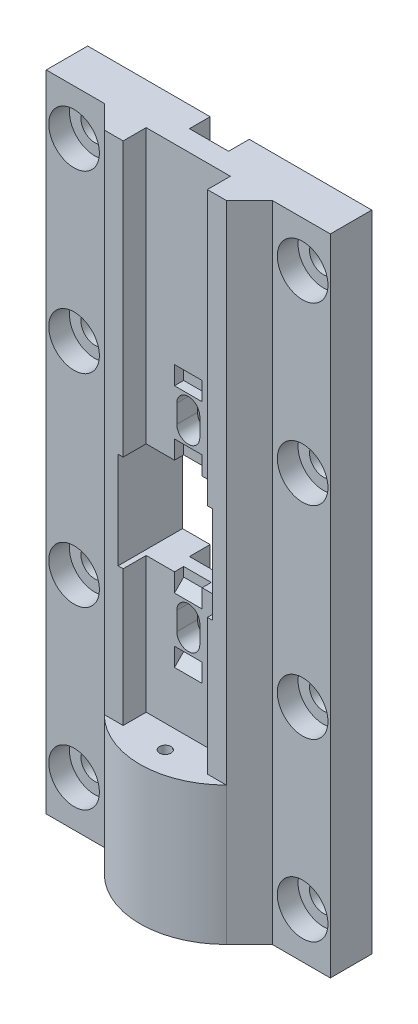
from build123d import *

# Parameters (mm, degrees)
SKETCH1_W                = 26.611
SKETCH1_H                = 70
SKETCH1_R                = 3
BOSS_EXTRUDE1_DEPTH      = 4.5
BOSS_EXTRUDE1_2_DEPTH    = 4.5
SKETCH2_W                = 61.722
SKETCH2_H                = 70
SKETCH2_R                = 5.5
BOSS_EXTRUDE2_DEPTH      = 4.5
SKETCH3_W                = 3
SKETCH3_H                = 70
BOSS_EXTRUDE3_DEPTH      = 5
CHAMFER1_SIZE            = 5
CUT_EXTRUDE1_DEPTH       = 53.134549552
CUT_EXTRUDE1_DEPTH_BACK  = 53.134549552
SKETCH4_W                = 20.5
SKETCH4_H                = 10.5
MIRROR1_OUTLINE_R        = 5.5
MIRROR1_DEPTH            = 9
MIRROR1_START            = 4.5
MIRROR1_2_OUTLINE_W      = 8.5
MIRROR1_2_OUTLINE_H      = 59.5
MIRROR1_2_DEPTH          = 4.5
MIRROR1_3_OUTLINE_R      = 5.5
MIRROR1_3_OUTLINE_R_2    = 3
MIRROR1_3_DEPTH          = 4.5
MIRROR1_START_2          = -111.044
MIRROR1_4_DEPTH          = 70
SKETCH5_R                = 1.25
BOSS_EXTRUDE4_DEPTH      = 30
SKETCH6_W                = 1.1
SKETCH6_H                = 59.5
BOSS_EXTRUDE5_DEPTH      = 5
SKETCH7_W                = 6
SKETCH7_H                = 4
CUT_EXTRUDE2_DEPTH       = 2
CHAMFER2_SIZE            = 2
CHAMFER3_SIZE            = 2
CHAMFER2_OF_MIRROR2_SIZE = 2
CHAMFER3_OF_MIRROR2_SIZE = 2


with BuildPart() as part:
    # Sketch1 → Boss-Extrude1 (new body)
    with BuildSketch(Plane.XY):
        with Locations((17.5555, -6.044)):
            Rectangle(SKETCH1_W, SKETCH1_H)
        with Locations((24.8412, 19.05)):
            Circle(SKETCH1_R, mode=Mode.SUBTRACT)
        with Locations((24.8412, -19.05)):
            Circle(SKETCH1_R, mode=Mode.SUBTRACT)
    extrude(amount=BOSS_EXTRUDE1_DEPTH)



with BuildPart() as body_2:
    # Sketch1 → Boss-Extrude1 2 (new body)
    with BuildSketch(Plane.XY):
        with Locations((-17.5555, -6.044)):
            Rectangle(SKETCH1_W, SKETCH1_H)
        with Locations((-24.8158, -19.05)):
            Circle(SKETCH1_R, mode=Mode.SUBTRACT)
        with Locations((-24.8158, 19.05)):
            Circle(SKETCH1_R, mode=Mode.SUBTRACT)
    extrude(amount=BOSS_EXTRUDE1_2_DEPTH)


with BuildPart() as part_1:
    add(part.part)

    add(body_2.part)  # Boss-Extrude2 merges body 2
    # Sketch2 → Boss-Extrude2 (add)
    with BuildSketch(Plane.XY.offset(4.5)):
        with Locations((0, -6.044)):
            Rectangle(SKETCH2_W, SKETCH2_H)
        with Locations((24.8412, -19.05)):
            Circle(SKETCH2_R, mode=Mode.SUBTRACT)
        with Locations((-24.8158, -19.05)):
            Circle(SKETCH2_R, mode=Mode.SUBTRACT)
        with Locations((-24.8158, 19.05)):
            Circle(SKETCH2_R, mode=Mode.SUBTRACT)
        with Locations((24.8412, 19.05)):
            Circle(SKETCH2_R, mode=Mode.SUBTRACT)
    extrude(amount=BOSS_EXTRUDE2_DEPTH)

    # Sketch3 → Boss-Extrude3 (add)
    with BuildSketch(Plane.XY.offset(9)):
        with Locations((11.75, -6.044)):
            Rectangle(SKETCH3_W, SKETCH3_H)
        with Locations((-11.75, -6.044)):
            Rectangle(SKETCH3_W, SKETCH3_H)
    extrude(amount=BOSS_EXTRUDE3_DEPTH)

    # Chamfer1
    chamfer1_edges = [part_1.edges().sort_by_distance(p)[0] for p in [
        (-13.25, -6.044, 9),
        (13.25, -6.044, 9),
    ]]
    chamfer(chamfer1_edges, length=CHAMFER1_SIZE - 0.0001)  # a hair under: the kernel refuses the full size

    # Sketch4 → Cut-Extrude1 (cut, two sides: drawn at the far end of the back side and taken through both)
    with BuildSketch(Plane.XY.offset(9).offset(-CUT_EXTRUDE1_DEPTH_BACK)):
        with Locations((0, -35.794)):
            Rectangle(SKETCH4_W, SKETCH4_H)
        with BuildLine():
            Line((-2.5, -23.544), (-2.5, -19.544))
            ThreePointArc((-2.5, -19.544), (0, -17.044), (2.5, -19.544))
            Line((2.5, -19.544), (2.5, -23.544))
            ThreePointArc((2.5, -23.544), (0, -26.044), (-2.5, -23.544))
        make_face()
    extrude(amount=CUT_EXTRUDE1_DEPTH + CUT_EXTRUDE1_DEPTH_BACK, mode=Mode.SUBTRACT)

    # Mirror1: read off the stored shape, not the designer's step
    # Mirror1 outline → Mirror1 (add)
    # profile 1 of 2: a face of its own
    with BuildSketch(Plane.XY):
        Polygon((30.861, -111.044), (30.861, -41.044), (10.25, -41.044), (10.25, -51.544), (4.25, -51.544), (4.25, -111.044), align=None)
        with Locations((24.8412, -101.138)):
            Circle(MIRROR1_OUTLINE_R, mode=Mode.SUBTRACT)
        with Locations((24.8412, -63.038)):
            Circle(MIRROR1_OUTLINE_R, mode=Mode.SUBTRACT)
    # profile 2 of 2: a face of its own
    with BuildSketch(Plane.XY):
        Polygon((-4.25, -111.044), (-4.25, -51.544), (-10.25, -51.544), (-10.25, -41.044), (-30.861, -41.044), (-30.861, -111.044), align=None)
        with Locations((-24.8158, -63.038)):
            Circle(MIRROR1_OUTLINE_R, mode=Mode.SUBTRACT)
        with Locations((-24.8158, -101.138)):
            Circle(MIRROR1_OUTLINE_R, mode=Mode.SUBTRACT)
    extrude(amount=MIRROR1_DEPTH)

    # Mirror1 2 outline → Mirror1 2 (add)
    with BuildSketch(Plane.XY.offset(MIRROR1_START)):
        with Locations((0, -81.294)):
            Rectangle(MIRROR1_2_OUTLINE_W, MIRROR1_2_OUTLINE_H)
        with BuildLine():
            Line((-2.5, -62.544), (-2.5, -58.544))
            ThreePointArc((-2.5, -58.544), (0, -56.044), (2.5, -58.544))
            Line((2.5, -58.544), (2.5, -62.544))
            ThreePointArc((2.5, -62.544), (0, -65.044), (-2.5, -62.544))
        make_face(mode=Mode.SUBTRACT)
    extrude(amount=MIRROR1_2_DEPTH)

    # Mirror1 3 outline → Mirror1 3 (add)
    # profile 1 of 4: a face of its own
    with BuildSketch(Plane.XY):
        with Locations((24.8412, -63.038)):
            Circle(MIRROR1_3_OUTLINE_R)
        with Locations((24.8412, -63.038)):
            Circle(MIRROR1_3_OUTLINE_R_2, mode=Mode.SUBTRACT)
    # profile 2 of 4: a face of its own
    with BuildSketch(Plane.XY):
        with Locations((-24.8158, -63.038)):
            Circle(MIRROR1_3_OUTLINE_R)
        with Locations((-24.8158, -63.038)):
            Circle(MIRROR1_3_OUTLINE_R_2, mode=Mode.SUBTRACT)
    # profile 3 of 4: a face of its own
    with BuildSketch(Plane.XY):
        with Locations((-24.8158, -101.138)):
            Circle(MIRROR1_3_OUTLINE_R)
        with Locations((-24.8158, -101.138)):
            Circle(MIRROR1_3_OUTLINE_R_2, mode=Mode.SUBTRACT)
    # profile 4 of 4: a face of its own
    with BuildSketch(Plane.XY):
        with Locations((24.8412, -101.138)):
            Circle(MIRROR1_3_OUTLINE_R)
        with Locations((24.8412, -101.138)):
            Circle(MIRROR1_3_OUTLINE_R_2, mode=Mode.SUBTRACT)
    extrude(amount=MIRROR1_3_DEPTH)

    # Mirror1 4 outline → Mirror1 4 (add)
    with BuildSketch(Plane(origin=(0, 0, 0), x_dir=(1, 0, 0), z_dir=(0, 1, 0)).offset(MIRROR1_START_2)):
        Polygon((-10.25, -14), (-10.25, -9), (-18.25, -9), (-13.25, -14), align=None)
        Polygon((10.25, -9), (10.25, -14), (13.25, -14), (18.25, -9), align=None)
    extrude(amount=MIRROR1_4_DEPTH)

    # Sketch5 → Boss-Extrude4 (add)
    with BuildSketch(Plane.XZ.offset(111.044)):
        with BuildLine():
            Line((-13.25, 14), (-13.25, 9))
            Line((-13.25, 9), (13.25, 9))
            Line((13.25, 9), (13.25, 14))
            ThreePointArc((13.25, 14), (0, 19.488329701), (-13.25, 14))
        make_face()
        with Locations(Location((0, 14, 0), (0, 0, 270))):
            Circle(SKETCH5_R, mode=Mode.SUBTRACT)
    extrude(amount=-BOSS_EXTRUDE4_DEPTH)

    # Sketch6 → Boss-Extrude5 (add)
    with BuildSketch(Plane.XY.offset(9)):
        with Locations((-9.7, -0.794)):
            Rectangle(SKETCH6_W, SKETCH6_H)
        with Locations((9.7, -0.794)):
            Rectangle(SKETCH6_W, SKETCH6_H)
    boss_extrude5 = extrude(amount=BOSS_EXTRUDE5_DEPTH)

    # Sketch7 → Cut-Extrude2 (cut)
    with BuildSketch(Plane.XY.offset(9)):
        with Locations((0, -14.544)):
            Rectangle(SKETCH7_W, SKETCH7_H)
        with Locations((0, -28.544)):
            Rectangle(SKETCH7_W, SKETCH7_H)
    cut_extrude2 = extrude(amount=-CUT_EXTRUDE2_DEPTH, mode=Mode.SUBTRACT)

    # Chamfer2
    chamfer2_edges = [part_1.edges().sort_by_distance(p)[0] for p in [
        (0, -26.544, 7),
    ]]
    chamfer(chamfer2_edges, length=CHAMFER2_SIZE - 0.0001)  # a hair under: the kernel refuses the full size

    # Chamfer3
    chamfer3_edges = [part_1.edges().sort_by_distance(p)[0] for p in [
        (0, -12.544, 7),
    ]]
    chamfer(chamfer3_edges, length=CHAMFER3_SIZE - 0.0001)  # a hair under: the kernel refuses the full size

    # Mirror2: Boss-Extrude5, Cut-Extrude2 across plane
    add(boss_extrude5.mirror(Plane(origin=(0, -41.044, 0), x_dir=(0, 0, 1), z_dir=(0, -1, 0))))
    add(cut_extrude2.mirror(Plane(origin=(0, -41.044, 0), x_dir=(0, 0, 1), z_dir=(0, -1, 0))), mode=Mode.SUBTRACT)

    # Chamfer2 of Mirror2
    chamfer2_of_mirror2_edges = [part_1.edges().sort_by_distance(p)[0] for p in [
        (0, -55.544, 7),
    ]]
    chamfer(chamfer2_of_mirror2_edges, length=CHAMFER2_OF_MIRROR2_SIZE - 0.0001)  # a hair under: the kernel refuses the full size

    # Chamfer3 of Mirror2
    chamfer3_of_mirror2_edges = [part_1.edges().sort_by_distance(p)[0] for p in [
        (0, -69.544, 7),
    ]]
    chamfer(chamfer3_of_mirror2_edges, length=CHAMFER3_OF_MIRROR2_SIZE - 0.0001)  # a hair under: the kernel refuses the full size


solid = part_1.part
